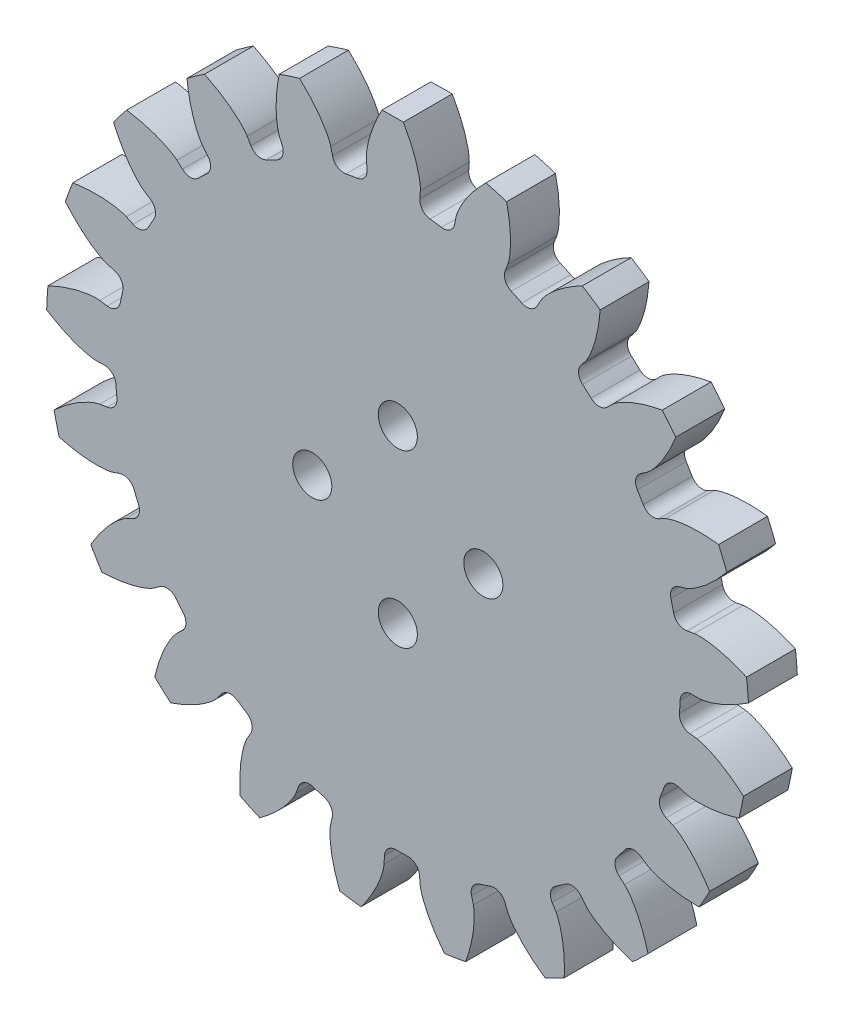
from build123d import *

# Parameters (mm, degrees)
SKETCH_2_R                       = 28.75
EXTRUDE_1_DEPTH                  = 4
CUT_EXTRUDE_START                = -4
CUT_EXTRUDE_1_DEPTH              = 4
FILLET_1_R                       = 0.95
PATTERN_CIRCULAR_1_COUNT         = 21
PATTERN_CIRCULAR_1_ANGLE         = 342.8
FILLET_1_OF_PATTERN_CIRCULAR_1_R = 0.95
SKETCH_4_R                       = 1.6
CUT_EXTRUDE_2_DEPTH              = 4
PATTERN_CIRCULAR_2_COUNT         = 4


with BuildPart() as part:
    # 草圖2 → 填料-伸長1 (new body)
    with BuildSketch(Plane.XY):
        Circle(SKETCH_2_R)
    extrude(amount=EXTRUDE_1_DEPTH)

    # 草圖3 → 除料-伸長1 (cut)
    with BuildSketch(Plane.XY.offset(4).offset(CUT_EXTRUDE_START)):
        with BuildLine():
            Line((24.490943683, -2.94128833), (22.960013384, -2.757428227))
            ThreePointArc((22.960013384, -2.757428227), (23.083716496, -1.381179841), (23.125, 0))
            Line((23.125, 0), (24.666931296, 0))
            add(Edge.make_bspline(
                [(24.666931296, 0), (24.678180389, 0.000186935), (24.709718602, 0.001290025), (24.76927505, 0.005660606), (24.866249545, 0.01603263), (24.989423733, 0.034002189), (25.148026609, 0.062670164), (25.33394305, 0.103416868), (25.537108016, 0.155472249), (25.756707342, 0.219915147), (25.97437237, 0.291077856), (26.190046746, 0.368422167), (26.403489059, 0.451178988), (26.660231422, 0.55812023), (26.965486915, 0.6956361), (27.318106854, 0.869742531), (27.712807861, 1.082878252), (28.108960174, 1.316601075), (28.401409037, 1.501727514), (28.596839672, 1.632149559), (28.695630482, 1.699562017), (28.699561927, 1.702247098)],
                knots=[0, 0, 0, 0, 0, 0.005376749, 0.015083688, 0.02853182, 0.046610139, 0.064854849, 0.092110525, 0.119476176, 0.146842496, 0.174208854, 0.201574956, 0.228941013, 0.256307345, 0.307035032, 0.361767352, 0.416499661, 0.471231936, 0.525964282, 0.528233552, 0.528233552, 0.528233552, 0.528233552, 0.528233552], degree=4))
            ThreePointArc((28.699561927, 1.702247098), (28.698674562, -1.717142505), (28.291827103, -5.112242089))
            add(Edge.make_bspline(
                [(24.490943683, -2.94128833), (24.50209023, -2.942815275), (24.533271899, -2.947671115), (24.591882289, -2.959112033), (24.686928153, -2.98097331), (24.807080855, -3.013501971), (24.961133796, -3.060877243), (25.140865163, -3.123501939), (25.336373546, -3.199411347), (25.546721948, -3.289579528), (25.754348582, -3.386188931), (25.95926167, -3.488698467), (26.161313232, -3.596315746), (26.403472163, -3.733108004), (26.690152383, -3.906041468), (27.01949606, -4.120952177), (27.385966717, -4.379631473), (27.751423517, -4.658924044), (28.019711384, -4.877601331), (28.198196165, -5.030396049), (28.288243877, -5.109107379), (28.291827103, -5.112242089)],
                knots=[0, 0, 0, 0, 0, 0.005376749, 0.015083688, 0.02853182, 0.046610139, 0.064854849, 0.092110525, 0.119476176, 0.146842496, 0.174208854, 0.201574956, 0.228941013, 0.256307345, 0.307035032, 0.361767352, 0.416499661, 0.471231936, 0.525964282, 0.528233552, 0.528233552, 0.528233552, 0.528233552, 0.528233552], degree=4))
        make_face()
    cut_extrude_1 = extrude(amount=CUT_EXTRUDE_1_DEPTH, mode=Mode.SUBTRACT)

    # 圓角1
    fillet_1_edges = [part.edges().sort_by_distance(p)[0] for p in [
        (22.960013384, -2.757428227, 2),
        (23.125, 0, 2),
    ]]
    fillet(fillet_1_edges, radius=FILLET_1_R)

    # 環狀複製排列1: 除料-伸長1 ×21 about axis
    pattern_circular_1_axis = Axis((0, 0, 4), (0, 0, 1))
    for i in range(1, PATTERN_CIRCULAR_1_COUNT):
        add(cut_extrude_1.rotate(pattern_circular_1_axis, i * PATTERN_CIRCULAR_1_ANGLE / (PATTERN_CIRCULAR_1_COUNT - 1)), mode=Mode.SUBTRACT)

    # 圓角1 of 環狀複製排列1
    fillet_1_of_pattern_circular_1_edges = [part.edges().sort_by_distance(p)[0] for p in [
        (22.752936701, 4.131524716, 2),
        (22.097961007, 6.815111468, 2),
        (20.524830553, 10.653495002, 2),
        (19.108070762, 13.0248707, 2),
        (16.473606456, 16.229168658, 2),
        (14.420906246, 18.077695872, 2),
        (10.959114365, 20.363286506, 2),
        (8.452804821, 21.524769817, 2),
        (4.471179006, 22.688635554, 2),
        (1.733883058, 23.059906213, 2),
        (-2.413908801, 22.998666685, 2),
        (-5.139050857, 22.546746579, 2),
        (-9.084581173, 21.265841387, 2),
        (-11.555508611, 20.030872316, 2),
        (-14.948315677, 17.644077857, 2),
        (-16.945548382, 15.735755941, 2),
        (-19.484266132, 12.455079217, 2),
        (-20.83039992, 10.04291114, 2),
        (-22.289526765, 6.159758242, 2),
        (-22.864991312, 3.458004817, 2),
        (-23.114920318, -0.682703223, 2),
        (-22.868599988, -3.434058763, 2),
        (-21.887131214, -7.464523578, 2),
        (-20.840905409, -10.021092093, 2),
        (-18.715217811, -13.583307671, 2),
        (-16.962017532, -15.71800198, 2),
        (-13.8809253, -18.495554542, 2),
        (-11.576478551, -20.018760435, 2),
        (-7.813659683, -21.764933893, 2),
        (-5.162658933, -22.541352616, 2),
        (-1.052345792, -23.101043122, 2),
        (1.709733834, -23.061709287, 2),
        (5.802442708, -22.385202336, 2),
        (8.430259504, -21.533609769, 2),
        (12.141829269, -19.680996087, 2),
        (14.401967424, -18.092787495, 2),
        (17.402717919, -15.22862548, 2),
        (19.094420674, -13.04487348, 2),
        (21.117810255, -9.423572307, 2),
        (22.090812124, -6.838248657, 2),
    ]]
    fillet(fillet_1_of_pattern_circular_1_edges, radius=FILLET_1_OF_PATTERN_CIRCULAR_1_R)

    # 草圖4 → 除料-伸長2 (cut)
    with BuildSketch(Plane.XY.offset(4)):
        with Locations((7, 0)):
            Circle(SKETCH_4_R)
    cut_extrude_2 = extrude(amount=-CUT_EXTRUDE_2_DEPTH, mode=Mode.SUBTRACT)

    # 環狀複製排列2: 除料-伸長2 ×4 about axis
    pattern_circular_2_axis = Axis((0, 0, 0), (0, 0, 1))
    for i in range(1, PATTERN_CIRCULAR_2_COUNT):
        add(cut_extrude_2.rotate(pattern_circular_2_axis, i * 360 / PATTERN_CIRCULAR_2_COUNT), mode=Mode.SUBTRACT)


solid = part.part
